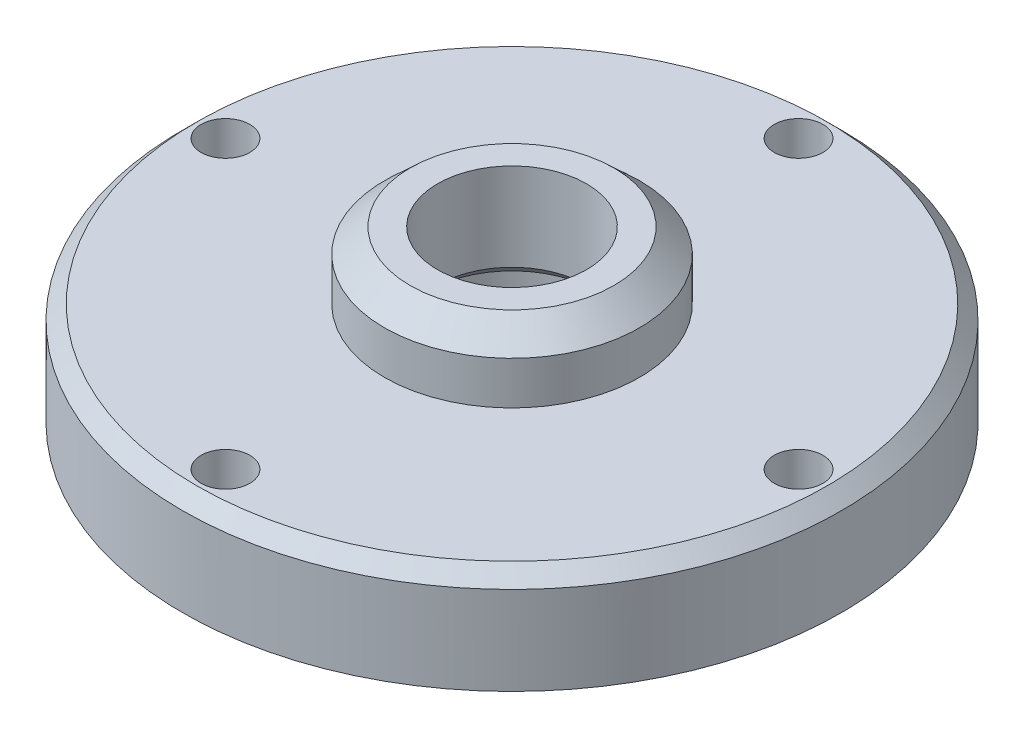
from build123d import *

# Parameters (mm, degrees)
M3_CLEARANCE_HOLE1_D = 3.4
CIRPATTERN1_COUNT    = 4
CHAMFER1_SIZE        = 0.75
CHAMFER2_SIZE        = 1


with BuildPart() as part:
    # Sketch1 → Revolve1 (revolve)
    with BuildSketch(Plane.XY):
        Polygon((6.8, 0), (6.8, 4.953), (5.2, 4.953), (5.2, 11.829), (7.112, 11.829), (8.9, 10.1665), (8.9, 7.1665), (23, 7.1665), (23, 0), align=None)
    revolve(axis=Axis((0, 0, 0), (0, 1, 0)))

    # M3 Clearance Hole1 (through all)
    with Locations(Plane.XZ):
        with Locations((-20, 0)):
            m3_clearance_hole1 = Hole(M3_CLEARANCE_HOLE1_D / 2)

    # CirPattern1: M3 Clearance Hole1 ×4 about axis
    cirpattern1_axis = Axis((0, 0, 0), (0, -1, 0))
    for i in range(1, CIRPATTERN1_COUNT):
        add(m3_clearance_hole1.rotate(cirpattern1_axis, i * 360 / CIRPATTERN1_COUNT), mode=Mode.SUBTRACT)

    # Chamfer1
    chamfer1_edges = [part.edges().sort_by_distance(p)[0] for p in [
        (-5.2, 4.953, 0),
        (-6.8, 0, 0),
    ]]
    chamfer(chamfer1_edges, length=CHAMFER1_SIZE)

    # Chamfer2
    chamfer2_edges = [part.edges().sort_by_distance(p)[0] for p in [
        (-23, 7.1665, 0),
    ]]
    chamfer(chamfer2_edges, length=CHAMFER2_SIZE)


solid = part.part
